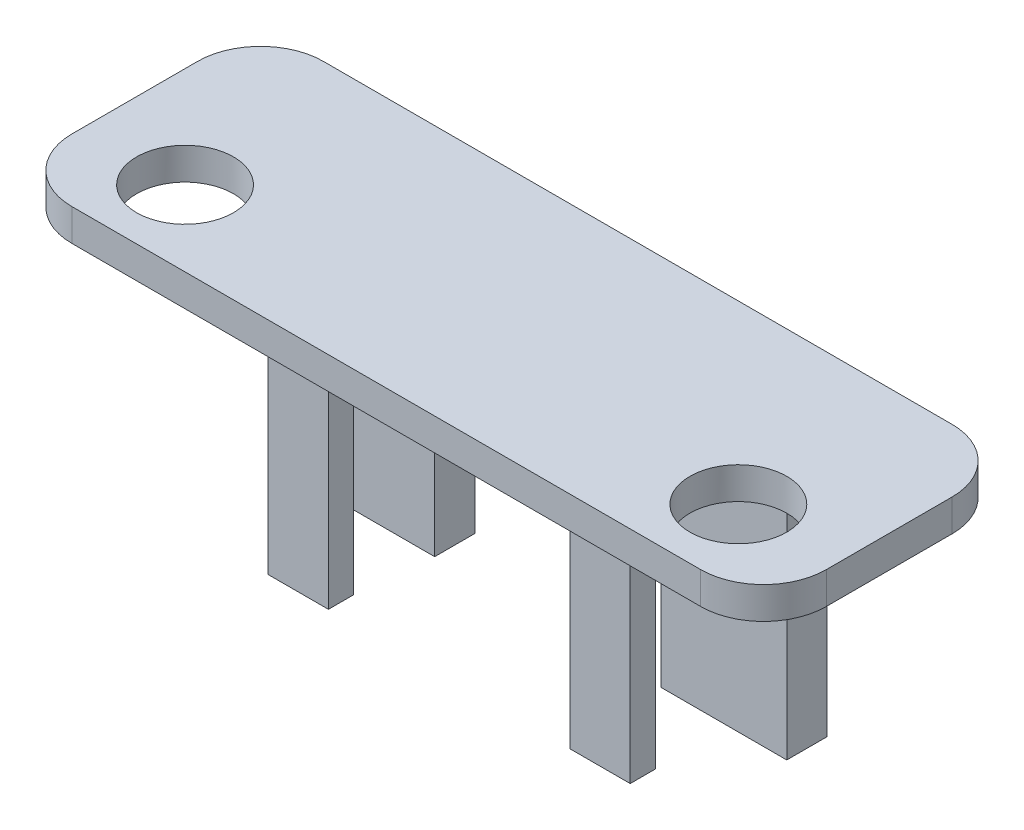
from build123d import *

# Parameters (mm, degrees)
SKETCH1_W            = 60
SKETCH1_H            = 20
BOSS_EXTRUDE1_DEPTH  = 2.54
SKETCH2_R            = 3.85
EYESHAFT_HOLES_DEPTH = 10
SKETCH5_W            = 4.8
SKETCH5_H            = 2
FRONT_LEGS_DEPTH     = 20
SKETCH7_W            = 10
SKETCH7_H            = 3.2
BACK_LEGS_DEPTH      = 20
FILLET2_R            = 5


with BuildPart() as part:
    # Sketch1 → Boss-Extrude1 (new body)
    with BuildSketch(Plane(origin=(0, 0, 0), x_dir=(1, 0, 0), z_dir=(0, 1, 0))):
        Rectangle(SKETCH1_W, SKETCH1_H)
    extrude(amount=BOSS_EXTRUDE1_DEPTH)

    # Sketch2 → Eyeshaft holes (cut)
    with BuildSketch(Plane(origin=(0, 2.54, 0), x_dir=(1, 0, 0), z_dir=(0, 1, 0))):
        with Locations((-22, -4)):
            Circle(SKETCH2_R)
        with Locations((22, -4)):
            Circle(SKETCH2_R)
    extrude(amount=-EYESHAFT_HOLES_DEPTH, mode=Mode.SUBTRACT)

    # Sketch5 → Front Legs (add)
    with BuildSketch(Plane.XZ):
        with Locations((-12, 4)):
            Rectangle(SKETCH5_W, SKETCH5_H)
        with Locations((12, 4)):
            Rectangle(SKETCH5_W, SKETCH5_H)
    extrude(amount=FRONT_LEGS_DEPTH)

    # Sketch7 → Back legs (add)
    with BuildSketch(Plane.XZ):
        with Locations((-14, -4.45)):
            Rectangle(SKETCH7_W, SKETCH7_H)
        with Locations((14, -4.45)):
            Rectangle(SKETCH7_W, SKETCH7_H)
    extrude(amount=BACK_LEGS_DEPTH)

    # Fillet2
    fillet2_edges = [part.edges().sort_by_distance(p)[0] for p in [
        (-30, 1.27, -10),
        (-30, 1.27, 10),
        (30, 1.27, 10),
        (30, 1.27, -10),
    ]]
    fillet(fillet2_edges, radius=FILLET2_R)


solid = part.part
